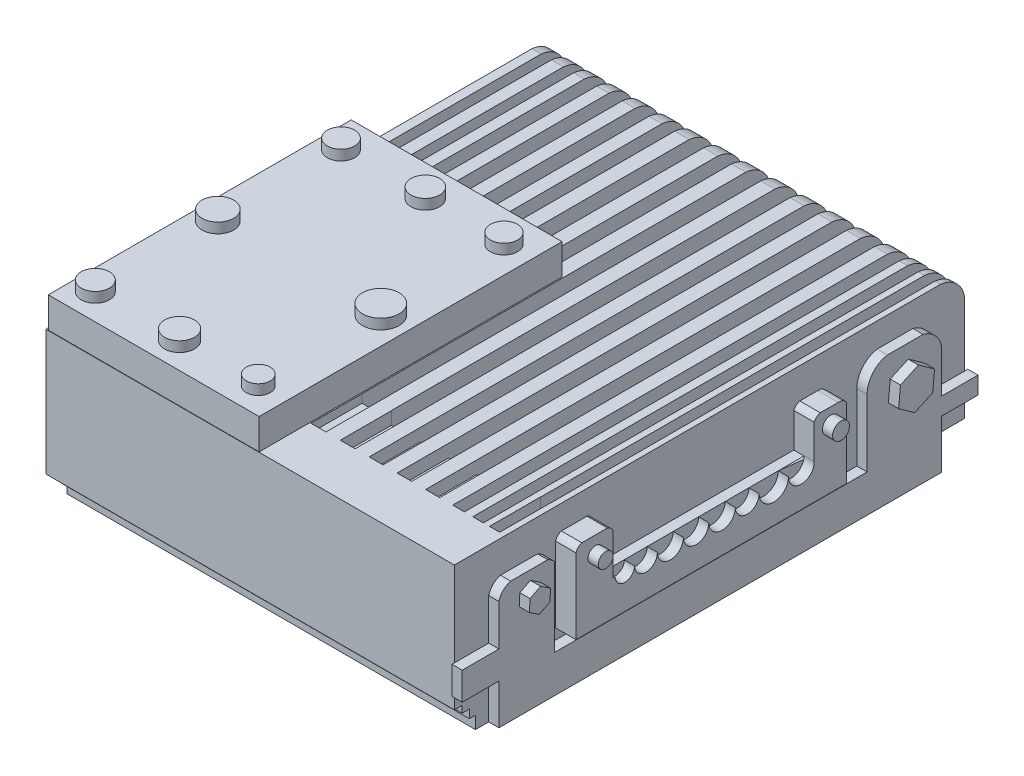
from build123d import *

# Parameters (mm, degrees)
SKETCH1_W                  = 40
SKETCH1_H                  = 50
BOSS_EXTRUDE1_DEPTH        = 15
SKETCH3_W                  = 1
SKETCH3_H                  = 7
CUT_EXTRUDE1_DEPTH         = 40
SKETCH4_W                  = 1
SKETCH4_H                  = 6.900667207
SKETCH4_W_2                = 1.202692516
SKETCH4_W_3                = 1.299116933
SKETCH4_W_4                = 1.350471364
SKETCH4_W_5                = 1.251319283
SKETCH4_W_6                = 1.412280681
SKETCH4_W_7                = 1.341208937
SKETCH4_W_8                = 1.471868654
SKETCH4_W_9                = 1.472487807
SKETCH4_W_10               = 1.35818292
SKETCH4_W_11               = 1.42447769
SKETCH4_W_12               = 1.379758693
SKETCH4_H_2                = 6.997721044
SKETCH4_W_13               = 1.144217978
SKETCH4_W_14               = 1.04194513
SKETCH4_W_15               = 0.993609091
CUT_EXTRUDE3_DEPTH         = 40
CUT_EXTRUDE4_DEPTH         = 50.497474683
SKETCH6_W                  = 20.655400888
SKETCH6_H                  = 29.67747551
BOSS_EXTRUDE2_DEPTH        = 3
SKETCH7_R                  = 1.171832759
SKETCH7_R_2                = 1.79196133
SKETCH7_R_3                = 1.329202126
SKETCH7_R_4                = 1.404193815
SKETCH7_R_5                = 1.342632465
SKETCH7_R_6                = 1.549252571
SKETCH7_R_7                = 1.383949344
SKETCH7_R_8                = 1.464567205
BOSS_EXTRUDE3_DEPTH        = 1
SKETCH8_W                  = 1.468469694
SKETCH8_H                  = 0.805510205
CUT_EXTRUDE5_DEPTH         = 5
SKETCH9_W                  = 1.453990677
SKETCH9_H                  = 1.238595275
SKETCH9_W_2                = 1.35818292
SKETCH9_W_3                = 1.42447769
SKETCH9_W_4                = 1.379758693
SKETCH9_W_5                = 1.144217978
SKETCH9_W_6                = 1.04194513
SKETCH9_W_7                = 0.995352598
CUT_EXTRUDE6_DEPTH         = 5
BOSS_EXTRUDE4_DEPTH        = 1
SKETCH13_W                 = 2.599629932
SKETCH13_H                 = 2.834597938
CUT_EXTRUDE8_DEPTH         = 3
SKETCH14_W                 = 3.561729757
SKETCH14_H                 = 1.694465913
BOSS_EXTRUDE7_DEPTH        = 1
SKETCH15_W                 = 2.286690669
SKETCH15_H                 = 1.225383502
CUT_EXTRUDE10_DEPTH        = 52.00059595
SKETCH16_W                 = 1.466493411
SKETCH16_H                 = 0.816321603
CUT_EXTRUDE11_DEPTH        = 52.00059595
SKETCH17_W                 = 0.797434214
SKETCH17_H                 = 0.720365981
CUT_EXTRUDE12_DEPTH        = 52.00059595
BOSS_EXTRUDE8_DEPTH        = 1
BOSS_EXTRUDE9_DEPTH        = 1
SKETCH20_R                 = 0.847827751
BOSS_EXTRUDE10_DEPTH       = 1
SKETCH21_R                 = 0.847766693
BOSS_EXTRUDE11_DEPTH       = 1
BOSS_EXTRUDE12_DEPTH       = 1
BOSS_EXTRUDE15_OUTLINE_R   = 0.847766693
BOSS_EXTRUDE15_OUTLINE_R_2 = 0.847827751
BOSS_EXTRUDE15_DEPTH       = 1
SKETCH24_R                 = 0.828197541
BOSS_EXTRUDE16_DEPTH       = 1
SKETCH25_R                 = 0.731332636
BOSS_EXTRUDE17_DEPTH       = 1
SKETCH26_W                 = 13.518730854
SKETCH26_H                 = 5.097403801
BOSS_EXTRUDE18_DEPTH       = 5


# Read off the part's stored shape, not the designer's step: Boss-Extrude15
with BuildPart() as part:
    # Sketch1 → Boss-Extrude1 (new body)
    with BuildSketch(Plane(origin=(0, 0, 0), x_dir=(1, 0, 0), z_dir=(0, 1, 0))):
        Rectangle(SKETCH1_W, SKETCH1_H)
    extrude(amount=BOSS_EXTRUDE1_DEPTH)

    # Sketch3 → Cut-Extrude1 (cut)
    with BuildSketch(Plane(origin=(0, 0, -25), x_dir=(-1, 0, 0), z_dir=(0, 0, -1))):
        with Locations((18.596878168, 11.5)):
            Rectangle(SKETCH3_W, SKETCH3_H)
    extrude(amount=-CUT_EXTRUDE1_DEPTH, mode=Mode.SUBTRACT)

    # Sketch4 → Cut-Extrude3 (cut)
    with BuildSketch(Plane(origin=(0, 0, -25), x_dir=(-1, 0, 0), z_dir=(0, 0, -1))):
        with Locations((16.414473857, 11.549666397)):
            Rectangle(SKETCH4_W, SKETCH4_H)
        with Locations((14.257833478, 11.549666397)):
            Rectangle(SKETCH4_W_2, SKETCH4_H)
        with Locations((11.800740649, 11.549666397)):
            Rectangle(SKETCH4_W_3, SKETCH4_H)
        with Locations((9.210015154, 11.549666397)):
            Rectangle(SKETCH4_W_4, SKETCH4_H)
        with Locations((6.640588551, 11.549666397)):
            Rectangle(SKETCH4_W_5, SKETCH4_H)
        with Locations((3.887545153, 11.549666397)):
            Rectangle(SKETCH4_W_6, SKETCH4_H)
        with Locations((1.118927195, 11.549666397)):
            Rectangle(SKETCH4_W_7, SKETCH4_H)
        with Locations((-1.688340214, 11.549666397)):
            Rectangle(SKETCH4_W_8, SKETCH4_H)
        with Locations((-4.546149622, 11.549666397)):
            Rectangle(SKETCH4_W_9, SKETCH4_H)
        with Locations((-7.340538831, 11.549666397)):
            Rectangle(SKETCH4_W_10, SKETCH4_H)
        with Locations((-10.106618796, 11.549666397)):
            Rectangle(SKETCH4_W_11, SKETCH4_H)
        with Locations((-12.879295621, 11.598193315)):
            Rectangle(SKETCH4_W_12, SKETCH4_H_2)
        with Locations((-15.414892499, 11.549666397)):
            Rectangle(SKETCH4_W_13, SKETCH4_H)
        with Locations((-17.331587104, 11.549666397)):
            Rectangle(SKETCH4_W_14, SKETCH4_H)
        with Locations((-18.961637182, 11.549666397)):
            Rectangle(SKETCH4_W_15, SKETCH4_H)
    extrude(amount=-CUT_EXTRUDE3_DEPTH, mode=Mode.SUBTRACT)

    # Sketch5 → Cut-Extrude4 (cut, through all)
    with BuildSketch(Plane(origin=(20, 0, 0), x_dir=(0, 0, -1), z_dir=(1, 0, 0))):
        with BuildLine():
            ThreePointArc((25.017224195, 12.333007001), (24.175338408, 14.283442851), (22.178560768, 15.00859852))
            ThreePointArc((22.178560768, 15.00859852), (22.464881418, 18.673190105), (26.068108131, 17.946575858))
            ThreePointArc((26.068108131, 17.946575858), (28.713538826, 14.546190598), (25.017224195, 12.333007001))
        make_face()
    extrude(amount=-CUT_EXTRUDE4_DEPTH, mode=Mode.SUBTRACT)

    # Sketch6 → Boss-Extrude2 (add)
    with BuildSketch(Plane(origin=(0, 15, 0), x_dir=(1, 0, 0), z_dir=(0, 1, 0))):
        with Locations((-9.482935309, -10.127870511)):
            Rectangle(SKETCH6_W, SKETCH6_H)
    extrude(amount=BOSS_EXTRUDE2_DEPTH)

    # Sketch7 → Boss-Extrude3 (add)
    with BuildSketch(Plane(origin=(0, 18, 0), x_dir=(1, 0, 0), z_dir=(0, 1, 0))):
        with Locations(Location((-1.804946936, -22.400282494, 0), (0, 0, 90))):
            Circle(SKETCH7_R)
        with Locations(Location((-1.804946936, -10.396354101, 0), (0, 0, 90))):
            Circle(SKETCH7_R_2)
        with Locations(Location((-1.804946936, 1.669541575, 0), (0, 0, 90))):
            Circle(SKETCH7_R_3)
        with Locations(Location((-9.512984876, 1.669541575, 0), (0, 0, 90))):
            Circle(SKETCH7_R_4)
        with Locations(Location((-17.769092359, 1.669541575, 0), (0, 0, 90))):
            Circle(SKETCH7_R_5)
        with Locations(Location((-17.769092359, -10.396354101, 0), (0, 0, 90))):
            Circle(SKETCH7_R_6)
        with Locations(Location((-17.769092359, -22.400282494, 0), (0, 0, 90))):
            Circle(SKETCH7_R_7)
        with Locations(Location((-9.512984876, -22.400282494, 0), (0, 0, 90))):
            Circle(SKETCH7_R_8)
    extrude(amount=BOSS_EXTRUDE3_DEPTH)

    # Sketch8 → Cut-Extrude5 (cut)
    with BuildSketch(Plane(origin=(0, 0, 15), x_dir=(-1, 0, 0), z_dir=(0, 0, -1))):
        with Locations((-1.690039694, 14.597244898)):
            Rectangle(SKETCH8_W, SKETCH8_H)
    extrude(amount=-CUT_EXTRUDE5_DEPTH, mode=Mode.SUBTRACT)

    # Sketch9 → Cut-Extrude6 (cut)
    with BuildSketch(Plane(origin=(0, 0, 15), x_dir=(-1, 0, 0), z_dir=(0, 0, -1))):
        with Locations((-4.555398187, 14.380702363)):
            Rectangle(SKETCH9_W, SKETCH9_H)
        with Locations((-7.340538831, 14.380702363)):
            Rectangle(SKETCH9_W_2, SKETCH9_H)
        with Locations((-10.106618796, 14.380702363)):
            Rectangle(SKETCH9_W_3, SKETCH9_H)
        with Locations((-12.879295621, 14.380702363)):
            Rectangle(SKETCH9_W_4, SKETCH9_H)
        with Locations((-15.414892499, 14.380702363)):
            Rectangle(SKETCH9_W_5, SKETCH9_H)
        with Locations((-17.331587104, 14.380702363)):
            Rectangle(SKETCH9_W_6, SKETCH9_H)
        with Locations((-18.9456903, 14.380702363)):
            Rectangle(SKETCH9_W_7, SKETCH9_H)
    extrude(amount=-CUT_EXTRUDE6_DEPTH, mode=Mode.SUBTRACT)

    # Sketch10 → Boss-Extrude4 (add)
    with BuildSketch(Plane(origin=(20, 0, 0), x_dir=(0, 0, -1), z_dir=(1, 0, 0))):
        with BuildLine():
            Line((14.435213519, 0), (21.737692909, 0))
            Line((21.737692909, 0), (21.737692909, 10.615994786))
            ThreePointArc((21.737692909, 10.615994786), (21.124778999, 11.877264632), (19.925237896, 12.603602174))
            Line((19.925237896, 12.603602174), (16.408520902, 12.603602174))
            ThreePointArc((16.408520902, 12.603602174), (14.994037958, 11.78895708), (14.435213519, 10.255293532))
            Line((14.435213519, 10.255293532), (14.435213519, 3.675063372))
            Line((14.435213519, 3.675063372), (-16.165737147, 3.675063372))
            Line((-16.165737147, 3.675063372), (-16.165737147, 11.361709159))
            ThreePointArc((-16.165737147, 11.361709159), (-16.475403144, 11.658211154), (-16.847861164, 11.870535165))
            Line((-16.847861164, 11.870535165), (-20.477722548, 11.870535165))
            ThreePointArc((-20.477722548, 11.870535165), (-21.213021207, 11.451457509), (-21.631725956, 10.71594644))
            Line((-21.631725956, 10.71594644), (-21.631725956, 6.689425507))
            Line((-21.631725956, 6.689425507), (-25.227943056, 6.689425507))
            Line((-25.227943056, 6.689425507), (-25.227943056, 3.970880833))
            Line((-25.227943056, 3.970880833), (-21.631725956, 3.970880833))
            Line((-21.631725956, 3.970880833), (-21.631725956, 0))
            Line((-21.631725956, 0), (-16.165737147, 0))
            Line((-16.165737147, 0), (14.435213519, 0))
        make_face()
    extrude(amount=BOSS_EXTRUDE4_DEPTH)

    # Sketch13 → Cut-Extrude8 (cut)
    with BuildSketch(Plane(origin=(20, 0, 0), x_dir=(0, 0, -1), z_dir=(1, 0, 0))):
        with Locations((23.922372026, 1.022426427)):
            Rectangle(SKETCH13_W, SKETCH13_H)
    extrude(amount=-CUT_EXTRUDE8_DEPTH, mode=Mode.SUBTRACT)

    # Sketch14 → Boss-Extrude7 (add)
    with BuildSketch(Plane(origin=(20, 0, 0), x_dir=(0, 0, -1), z_dir=(1, 0, 0))):
        with Locations((23.518557788, 5.612035402)):
            Rectangle(SKETCH14_W, SKETCH14_H)
    extrude(amount=BOSS_EXTRUDE7_DEPTH)

    # Sketch15 → Cut-Extrude10 (cut, through all)
    with BuildSketch(Plane(origin=(20, 0, 0), x_dir=(0, 0, -1), z_dir=(1, 0, 0))):
        with Locations((-24.07810047, 0.612691751)):
            Rectangle(SKETCH15_W, SKETCH15_H)
    extrude(amount=-CUT_EXTRUDE10_DEPTH, mode=Mode.SUBTRACT)

    # Sketch16 → Cut-Extrude11 (cut, through all)
    with BuildSketch(Plane(origin=(20, 0, 0), x_dir=(0, 0, -1), z_dir=(1, 0, 0))):
        with Locations((-24.266753294, 1.633544304)):
            Rectangle(SKETCH16_W, SKETCH16_H)
    extrude(amount=-CUT_EXTRUDE11_DEPTH, mode=Mode.SUBTRACT)

    # Sketch17 → Cut-Extrude12 (cut, through all)
    with BuildSketch(Plane(origin=(20, 0, 0), x_dir=(0, 0, -1), z_dir=(1, 0, 0))):
        with Locations((-24.62764398, 2.352390114)):
            Rectangle(SKETCH17_W, SKETCH17_H)
    extrude(amount=-CUT_EXTRUDE12_DEPTH, mode=Mode.SUBTRACT)

    # Sketch18 → Boss-Extrude8 (add)
    with BuildSketch(Plane(origin=(20, 0, 0), x_dir=(0, 0, -1), z_dir=(1, 0, 0))):
        with BuildLine():
            Line((10.614460855, 11.991811371), (8.848362021, 11.991811371))
            ThreePointArc((8.848362021, 11.991811371), (8.491648012, 11.809058594), (8.256067442, 11.484797501))
            Line((8.256067442, 11.484797501), (8.256067442, 8.12415744))
            Line((8.256067442, 8.12415744), (-11.442953172, 8.12415744))
            Line((-11.442953172, 8.12415744), (-11.442953172, 12.06602109))
            ThreePointArc((-11.442953172, 12.06602109), (-11.654182682, 12.421939785), (-12.004369491, 12.642541738))
            Line((-12.004369491, 12.642541738), (-14.512909212, 12.642541738))
            ThreePointArc((-14.512909212, 12.642541738), (-14.870244582, 12.425907952), (-15.086784059, 12.068515425))
            Line((-15.086784059, 12.068515425), (-15.086784059, 4.704832912))
            Line((-15.086784059, 4.704832912), (-11.442953172, 4.704832912))
            Line((-11.442953172, 4.704832912), (8.256067442, 4.704832912))
            Line((8.256067442, 4.704832912), (11.438250023, 4.704832912))
            Line((11.438250023, 4.704832912), (11.438250023, 11.533765386))
            ThreePointArc((11.438250023, 11.533765386), (11.097277379, 11.890340476), (10.614460855, 11.991811371))
        make_face()
    extrude(amount=BOSS_EXTRUDE8_DEPTH)

    # Sketch19 → Boss-Extrude9 (add)
    with BuildSketch(Plane(origin=(21, 0, 0), x_dir=(0, 0, -1), z_dir=(1, 0, 0))):
        Polygon((16.523494523, 8.493778246), (18.103632227, 7.37363247), (19.863775777, 8.181998974), (20.043781624, 10.110511255), (18.46364392, 11.230657031), (16.70350037, 10.422290527), align=None)
    extrude(amount=BOSS_EXTRUDE9_DEPTH)

    # Sketch20 → Boss-Extrude10 (add)
    with BuildSketch(Plane(origin=(21, 0, 0), x_dir=(0, 0, -1), z_dir=(1, 0, 0))):
        with Locations((9.933194768, 10.633250775)):
            Circle(SKETCH20_R)
    extrude(amount=BOSS_EXTRUDE10_DEPTH)

    # Sketch21 → Boss-Extrude11 (add)
    with BuildSketch(Plane(origin=(21, 0, 0), x_dir=(0, 0, -1), z_dir=(1, 0, 0))):
        with Locations((-13.262534431, 11.316594074)):
            Circle(SKETCH21_R)
    extrude(amount=BOSS_EXTRUDE11_DEPTH)

    # Sketch22 → Boss-Extrude12 (add)
    with BuildSketch(Plane(origin=(21, 0, 0), x_dir=(0, 0, -1), z_dir=(1, 0, 0))):
        Polygon((-19.643149072, 9.283790838), (-18.672691111, 8.649896251), (-17.638493315, 9.173390206), (-17.574753481, 10.330778747), (-18.545211442, 10.964673333), (-19.579409238, 10.441179379), align=None)
    extrude(amount=BOSS_EXTRUDE12_DEPTH)

    # Boss-Extrude15 outline → Boss-Extrude15 (add)
    with BuildSketch(Plane(origin=(21, 0, 0), x_dir=(0, 0, -1), z_dir=(1, 0, 0))):
        with BuildLine():
            Line((11.438250023, 4.704832912), (11.438250023, 11.533765386))
            ThreePointArc((11.438250023, 11.533765386), (11.097277379, 11.890340476), (10.614460855, 11.991811371))
            Line((10.614460855, 11.991811371), (8.848362021, 11.991811371))
            ThreePointArc((8.848362021, 11.991811371), (8.491648012, 11.809058594), (8.256067442, 11.484797501))
            Line((8.256067442, 11.484797501), (8.256067442, 8.148286402))
            ThreePointArc((8.256067442, 8.148286402), (7.007757086, 6.863608844), (5.735085719, 8.12415744))
            ThreePointArc((5.735085719, 8.12415744), (4.297682415, 6.686754136), (2.860279111, 8.12415744))
            ThreePointArc((2.860279111, 8.12415744), (1.69525584, 6.959134169), (0.530232568, 8.12415744))
            ThreePointArc((0.530232568, 8.12415744), (-0.770098501, 6.823826371), (-2.070429569, 8.12415744))
            ThreePointArc((-2.070429569, 8.12415744), (-3.313199554, 6.881387455), (-4.555969538, 8.12415744))
            ThreePointArc((-4.555969538, 8.12415744), (-5.830483098, 6.84964388), (-7.104996658, 8.12415744))
            ThreePointArc((-7.104996658, 8.12415744), (-8.210389035, 7.005768344), (-9.341622051, 8.098012978))
            ThreePointArc((-9.341622051, 8.098012978), (-10.305326762, 7.173256614), (-11.243243988, 8.12415744))
            Line((-11.243243988, 8.12415744), (-11.442953172, 8.12415744))
            Line((-11.442953172, 8.12415744), (-11.442953172, 12.06602109))
            ThreePointArc((-11.442953172, 12.06602109), (-11.654182682, 12.421939785), (-12.004369491, 12.642541738))
            Line((-12.004369491, 12.642541738), (-14.512909212, 12.642541738))
            ThreePointArc((-14.512909212, 12.642541738), (-14.870244582, 12.425907952), (-15.086784059, 12.068515425))
            Line((-15.086784059, 12.068515425), (-15.086784059, 4.704832912))
            Line((-15.086784059, 4.704832912), (11.438250023, 4.704832912))
        make_face()
        with Locations((-13.262534431, 11.316594074)):
            Circle(BOSS_EXTRUDE15_OUTLINE_R, mode=Mode.SUBTRACT)
        with Locations((9.933194768, 10.633250775)):
            Circle(BOSS_EXTRUDE15_OUTLINE_R_2, mode=Mode.SUBTRACT)
    extrude(amount=BOSS_EXTRUDE15_DEPTH)

    # Sketch24 → Boss-Extrude16 (add)
    with BuildSketch(Plane(origin=(22, 0, 0), x_dir=(0, 0, -1), z_dir=(1, 0, 0))):
        with Locations((9.885152732, 10.450839148)):
            Circle(SKETCH24_R)
    extrude(amount=BOSS_EXTRUDE16_DEPTH)

    # Sketch25 → Boss-Extrude17 (add)
    with BuildSketch(Plane(origin=(22, 0, 0), x_dir=(0, 0, -1), z_dir=(1, 0, 0))):
        with Locations((-13.171384095, 11.001804291)):
            Circle(SKETCH25_R)
    extrude(amount=BOSS_EXTRUDE17_DEPTH)

    # Sketch26 → Boss-Extrude18 (add)
    with BuildSketch(Plane(origin=(0, 0, -25), x_dir=(-1, 0, 0), z_dir=(0, 0, -1))):
        with Locations((1.612181374, 4.266298284)):
            Rectangle(SKETCH26_W, SKETCH26_H)
    extrude(amount=BOSS_EXTRUDE18_DEPTH)


solid = part.part
